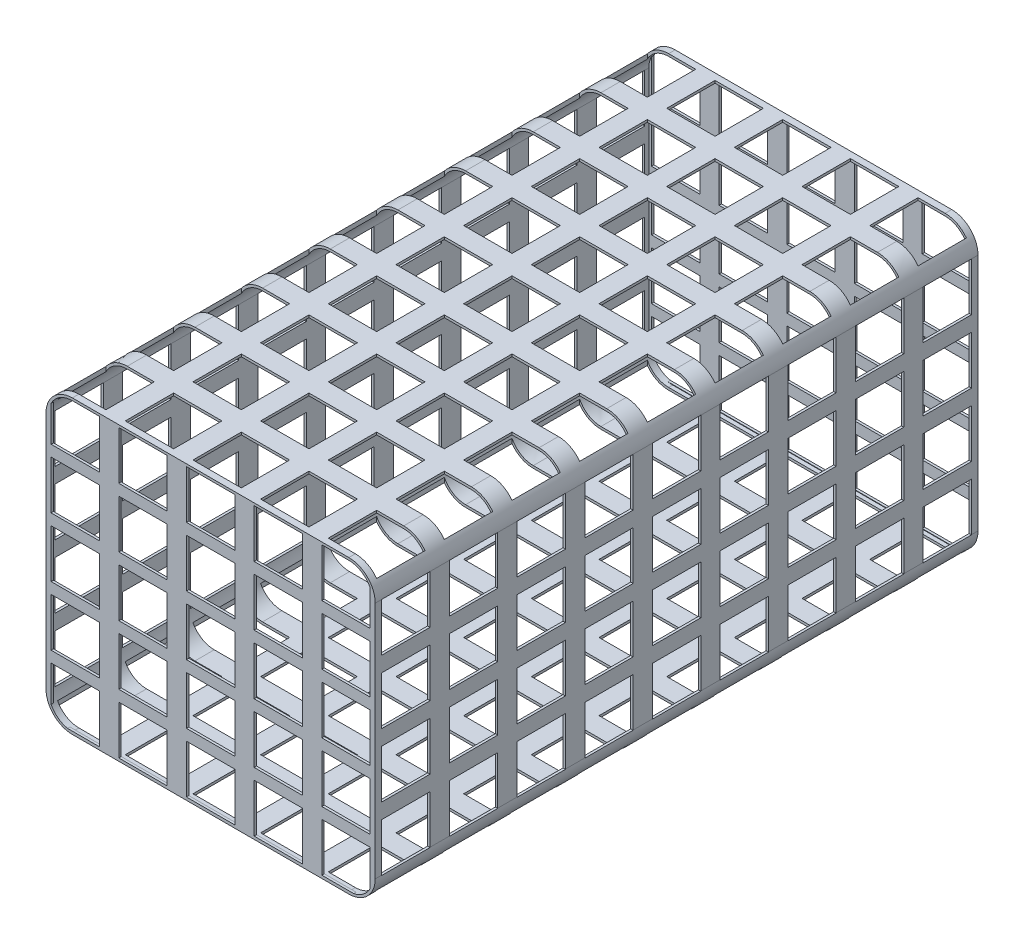
from build123d import *

# Parameters (mm, degrees)
BOSS_EXTRUDE2_DEPTH        = 158.369
SHELL1_T                   = 1.27
SKETCH4_W                  = 25.4
SKETCH4_H                  = 25.4
CUT_EXTRUDE1_DEPTH         = 237.684050105
MIRROR2_COPY_1_SKETCH_W    = 25.4
MIRROR2_COPY_1_SKETCH_H    = 25.4
MIRROR2_COPY_1_DEPTH       = 237.684050105
MIRROR2_COPY_2_SKETCH_W    = 25.4
MIRROR2_COPY_2_SKETCH_H    = 25.4
MIRROR2_COPY_2_DEPTH       = 237.684050105
SKETCH5_W                  = 25.4
SKETCH5_H                  = 25.4
CUT_EXTRUDE3_DEPTH         = 247.709129134
LPATTERN1_COUNT            = 4
LPATTERN1_PITCH            = 33.401
LPATTERN1_COUNT_DIR2       = 9
LPATTERN1_PITCH_DIR2       = 35.56
SKETCH6_W                  = 25.4
SKETCH6_H                  = 25.4
CUT_EXTRUDE4_DEPTH         = 338.146275931
LPATTERN2_COUNT            = 5
LPATTERN2_PITCH            = 31.242
LPATTERN3_COPY_1_SKETCH_W  = 25.4
LPATTERN3_COPY_1_SKETCH_H  = 25.4
LPATTERN3_COPY_1_DEPTH     = 338.146275931
LPATTERN3_COPY_2_SKETCH_W  = 25.4
LPATTERN3_COPY_2_SKETCH_H  = 25.4
LPATTERN3_COPY_2_DEPTH     = 338.146275931
LPATTERN3_COPY_3_SKETCH_W  = 25.4
LPATTERN3_COPY_3_SKETCH_H  = 25.4
LPATTERN3_COPY_3_DEPTH     = 338.146275931
LPATTERN3_COPY_4_SKETCH_W  = 25.4
LPATTERN3_COPY_4_SKETCH_H  = 25.4
LPATTERN3_COPY_4_DEPTH     = 338.146275931
LPATTERN3_COPY_5_SKETCH_W  = 25.4
LPATTERN3_COPY_5_SKETCH_H  = 25.4
LPATTERN3_COPY_5_DEPTH     = 338.146275931
LPATTERN3_COPY_6_SKETCH_W  = 25.4
LPATTERN3_COPY_6_SKETCH_H  = 25.4
LPATTERN3_COPY_6_DEPTH     = 338.146275931
LPATTERN3_COPY_7_SKETCH_W  = 25.4
LPATTERN3_COPY_7_SKETCH_H  = 25.4
LPATTERN3_COPY_7_DEPTH     = 338.146275931
LPATTERN3_COPY_8_SKETCH_W  = 25.4
LPATTERN3_COPY_8_SKETCH_H  = 25.4
LPATTERN3_COPY_8_DEPTH     = 338.146275931
LPATTERN3_COPY_9_SKETCH_W  = 25.4
LPATTERN3_COPY_9_SKETCH_H  = 25.4
LPATTERN3_COPY_9_DEPTH     = 338.146275931
LPATTERN3_COPY_10_SKETCH_W = 25.4
LPATTERN3_COPY_10_SKETCH_H = 25.4
LPATTERN3_COPY_10_DEPTH    = 338.146275931
LPATTERN3_COPY_11_SKETCH_W = 25.4
LPATTERN3_COPY_11_SKETCH_H = 25.4
LPATTERN3_COPY_11_DEPTH    = 338.146275931
LPATTERN3_COPY_12_SKETCH_W = 25.4
LPATTERN3_COPY_12_SKETCH_H = 25.4
LPATTERN3_COPY_12_DEPTH    = 338.146275931
LPATTERN3_COPY_13_SKETCH_W = 25.4
LPATTERN3_COPY_13_SKETCH_H = 25.4
LPATTERN3_COPY_13_DEPTH    = 338.146275931
LPATTERN3_COPY_14_SKETCH_W = 25.4
LPATTERN3_COPY_14_SKETCH_H = 25.4
LPATTERN3_COPY_14_DEPTH    = 338.146275931
LPATTERN3_COPY_15_SKETCH_W = 25.4
LPATTERN3_COPY_15_SKETCH_H = 25.4
LPATTERN3_COPY_15_DEPTH    = 338.146275931
SKETCH7_W                  = 25.4
SKETCH7_H                  = 25.4
CUT_EXTRUDE5_DEPTH         = 338.146275931


with BuildPart() as part:
    # Sketch1 → Boss-Extrude2 (new, symmetric)
    with BuildSketch(Plane.XY):
        with BuildLine():
            ThreePointArc((-86.487, -62.738), (-82.432479172, -72.526479172), (-72.644, -76.581))
            Line((-72.644, -76.581), (72.644, -76.581))
            ThreePointArc((72.644, -76.581), (82.432479172, -72.526479172), (86.487, -62.738))
            Line((86.487, -62.738), (86.487, 62.738))
            ThreePointArc((86.487, 62.738), (82.432479172, 72.526479172), (72.644, 76.581))
            Line((72.644, 76.581), (-72.644, 76.581))
            ThreePointArc((-72.644, 76.581), (-82.432479172, 72.526479172), (-86.487, 62.738))
            Line((-86.487, 62.738), (-86.487, -62.738))
        make_face()
    extrude(amount=BOSS_EXTRUDE2_DEPTH, both=True)

    # Shell1 (no face opened: a closed hollow body)
    add(offset(amount=-SHELL1_T, mode=Mode.PRIVATE), mode=Mode.SUBTRACT)

    # Sketch4 → Cut-Extrude1 (cut, through all)
    with BuildSketch(Plane(origin=(0, 76.581, 0), x_dir=(1, 0, 0), z_dir=(0, 1, 0))):
        with Locations((35.56, 0)):
            Rectangle(SKETCH4_W, SKETCH4_H)
        Rectangle(SKETCH4_W, SKETCH4_H)
        with Locations((71.12, 0)):
            Rectangle(SKETCH4_W, SKETCH4_H)
        with Locations((35.56, -35.56)):
            Rectangle(SKETCH4_W, SKETCH4_H)
        with Locations((71.12, -35.56)):
            Rectangle(SKETCH4_W, SKETCH4_H)
        with Locations((35.56, -71.12)):
            Rectangle(SKETCH4_W, SKETCH4_H)
        with Locations((71.12, -71.12)):
            Rectangle(SKETCH4_W, SKETCH4_H)
        with Locations((35.56, -106.68)):
            Rectangle(SKETCH4_W, SKETCH4_H)
        with Locations((71.12, -106.68)):
            Rectangle(SKETCH4_W, SKETCH4_H)
        with Locations((35.56, -142.24)):
            Rectangle(SKETCH4_W, SKETCH4_H)
        with Locations((71.12, -142.24)):
            Rectangle(SKETCH4_W, SKETCH4_H)
        with Locations((0, -35.56)):
            Rectangle(SKETCH4_W, SKETCH4_H)
        with Locations((0, -71.12)):
            Rectangle(SKETCH4_W, SKETCH4_H)
        with Locations((0, -106.68)):
            Rectangle(SKETCH4_W, SKETCH4_H)
        with Locations((0, -142.24)):
            Rectangle(SKETCH4_W, SKETCH4_H)
    cut_extrude1 = extrude(amount=-CUT_EXTRUDE1_DEPTH, mode=Mode.SUBTRACT)

    # Mirror1: Cut-Extrude1 across plane
    add(cut_extrude1.mirror(Plane.XY), mode=Mode.SUBTRACT)

    # Mirror2 copy 1 sketch → Mirror2 copy 1 (cut, through all)
    with BuildSketch(Plane(origin=(0, 76.581, 0), x_dir=(-1, 0, 0), z_dir=(0, 1, 0))):
        with Locations((35.56, 0)):
            Rectangle(MIRROR2_COPY_1_SKETCH_W, MIRROR2_COPY_1_SKETCH_H)
        Rectangle(MIRROR2_COPY_1_SKETCH_W, MIRROR2_COPY_1_SKETCH_H)
        with Locations((71.12, 0)):
            Rectangle(MIRROR2_COPY_1_SKETCH_W, MIRROR2_COPY_1_SKETCH_H)
        with Locations((35.56, -35.56)):
            Rectangle(MIRROR2_COPY_1_SKETCH_W, MIRROR2_COPY_1_SKETCH_H)
        with Locations((71.12, -35.56)):
            Rectangle(MIRROR2_COPY_1_SKETCH_W, MIRROR2_COPY_1_SKETCH_H)
        with Locations((35.56, -71.12)):
            Rectangle(MIRROR2_COPY_1_SKETCH_W, MIRROR2_COPY_1_SKETCH_H)
        with Locations((71.12, -71.12)):
            Rectangle(MIRROR2_COPY_1_SKETCH_W, MIRROR2_COPY_1_SKETCH_H)
        with Locations((35.56, -106.68)):
            Rectangle(MIRROR2_COPY_1_SKETCH_W, MIRROR2_COPY_1_SKETCH_H)
        with Locations((71.12, -106.68)):
            Rectangle(MIRROR2_COPY_1_SKETCH_W, MIRROR2_COPY_1_SKETCH_H)
        with Locations((35.56, -142.24)):
            Rectangle(MIRROR2_COPY_1_SKETCH_W, MIRROR2_COPY_1_SKETCH_H)
        with Locations((71.12, -142.24)):
            Rectangle(MIRROR2_COPY_1_SKETCH_W, MIRROR2_COPY_1_SKETCH_H)
        with Locations((0, -35.56)):
            Rectangle(MIRROR2_COPY_1_SKETCH_W, MIRROR2_COPY_1_SKETCH_H)
        with Locations((0, -71.12)):
            Rectangle(MIRROR2_COPY_1_SKETCH_W, MIRROR2_COPY_1_SKETCH_H)
        with Locations((0, -106.68)):
            Rectangle(MIRROR2_COPY_1_SKETCH_W, MIRROR2_COPY_1_SKETCH_H)
        with Locations((0, -142.24)):
            Rectangle(MIRROR2_COPY_1_SKETCH_W, MIRROR2_COPY_1_SKETCH_H)
    extrude(amount=-MIRROR2_COPY_1_DEPTH, mode=Mode.SUBTRACT)

    # Mirror2 copy 2 sketch → Mirror2 copy 2 (cut, through all)
    with BuildSketch(Plane(origin=(0, 76.581, 0), x_dir=(-1, 0, 0), z_dir=(0, 1, 0))):
        with Locations((35.56, 0)):
            Rectangle(MIRROR2_COPY_2_SKETCH_W, MIRROR2_COPY_2_SKETCH_H)
        Rectangle(MIRROR2_COPY_2_SKETCH_W, MIRROR2_COPY_2_SKETCH_H)
        with Locations((71.12, 0)):
            Rectangle(MIRROR2_COPY_2_SKETCH_W, MIRROR2_COPY_2_SKETCH_H)
        with Locations((35.56, 35.56)):
            Rectangle(MIRROR2_COPY_2_SKETCH_W, MIRROR2_COPY_2_SKETCH_H)
        with Locations((71.12, 35.56)):
            Rectangle(MIRROR2_COPY_2_SKETCH_W, MIRROR2_COPY_2_SKETCH_H)
        with Locations((35.56, 71.12)):
            Rectangle(MIRROR2_COPY_2_SKETCH_W, MIRROR2_COPY_2_SKETCH_H)
        with Locations((71.12, 71.12)):
            Rectangle(MIRROR2_COPY_2_SKETCH_W, MIRROR2_COPY_2_SKETCH_H)
        with Locations((35.56, 106.68)):
            Rectangle(MIRROR2_COPY_2_SKETCH_W, MIRROR2_COPY_2_SKETCH_H)
        with Locations((71.12, 106.68)):
            Rectangle(MIRROR2_COPY_2_SKETCH_W, MIRROR2_COPY_2_SKETCH_H)
        with Locations((35.56, 142.24)):
            Rectangle(MIRROR2_COPY_2_SKETCH_W, MIRROR2_COPY_2_SKETCH_H)
        with Locations((71.12, 142.24)):
            Rectangle(MIRROR2_COPY_2_SKETCH_W, MIRROR2_COPY_2_SKETCH_H)
        with Locations((0, 35.56)):
            Rectangle(MIRROR2_COPY_2_SKETCH_W, MIRROR2_COPY_2_SKETCH_H)
        with Locations((0, 71.12)):
            Rectangle(MIRROR2_COPY_2_SKETCH_W, MIRROR2_COPY_2_SKETCH_H)
        with Locations((0, 106.68)):
            Rectangle(MIRROR2_COPY_2_SKETCH_W, MIRROR2_COPY_2_SKETCH_H)
        with Locations((0, 142.24)):
            Rectangle(MIRROR2_COPY_2_SKETCH_W, MIRROR2_COPY_2_SKETCH_H)
    extrude(amount=-MIRROR2_COPY_2_DEPTH, mode=Mode.SUBTRACT)

    # Sketch5 → Cut-Extrude3 (cut, through all)
    with BuildSketch(Plane(origin=(86.487, 0, 0), x_dir=(0, 0, -1), z_dir=(1, 0, 0))):
        with Locations((-142.24, 50.038)):
            Rectangle(SKETCH5_W, SKETCH5_H)
    cut_extrude3 = extrude(amount=-CUT_EXTRUDE3_DEPTH, mode=Mode.SUBTRACT)

    # LPattern1: Cut-Extrude3 4 × 9
    with Locations(*[(0, -i * LPATTERN1_PITCH, -j * LPATTERN1_PITCH_DIR2) for i in range(LPATTERN1_COUNT) for j in range(LPATTERN1_COUNT_DIR2) if (i, j) != (0, 0)]):
        add(cut_extrude3, mode=Mode.SUBTRACT)

    # Sketch6 → Cut-Extrude4 (cut, through all)
    with BuildSketch(Plane.XY.offset(158.369)):
        with Locations((0, 62.611)):
            Rectangle(SKETCH6_W, SKETCH6_H)
    cut_extrude4 = extrude(amount=-CUT_EXTRUDE4_DEPTH, mode=Mode.SUBTRACT)

    # LPattern2: Cut-Extrude4 ×5
    with Locations(*[(0, -i * LPATTERN2_PITCH, 0) for i in range(1, LPATTERN2_COUNT)]):
        add(cut_extrude4, mode=Mode.SUBTRACT)

    # LPattern3 copy 1 sketch → LPattern3 copy 1 (cut, through all)
    with BuildSketch(Plane(origin=(35.56, -31.242, 158.369), x_dir=(1, 0, 0), z_dir=(0, 0, 1))):
        with Locations((0, 62.611)):
            Rectangle(LPATTERN3_COPY_1_SKETCH_W, LPATTERN3_COPY_1_SKETCH_H)
    extrude(amount=-LPATTERN3_COPY_1_DEPTH, mode=Mode.SUBTRACT)

    # LPattern3 copy 2 sketch → LPattern3 copy 2 (cut, through all)
    with BuildSketch(Plane(origin=(-35.56, -31.242, 158.369), x_dir=(1, 0, 0), z_dir=(0, 0, 1))):
        with Locations((0, 62.611)):
            Rectangle(LPATTERN3_COPY_2_SKETCH_W, LPATTERN3_COPY_2_SKETCH_H)
    extrude(amount=-LPATTERN3_COPY_2_DEPTH, mode=Mode.SUBTRACT)

    # LPattern3 copy 3 sketch → LPattern3 copy 3 (cut, through all)
    with BuildSketch(Plane(origin=(0, -31.242, 158.369), x_dir=(1, 0, 0), z_dir=(0, 0, 1))):
        with Locations((0, 62.611)):
            Rectangle(LPATTERN3_COPY_3_SKETCH_W, LPATTERN3_COPY_3_SKETCH_H)
    extrude(amount=-LPATTERN3_COPY_3_DEPTH, mode=Mode.SUBTRACT)

    # LPattern3 copy 4 sketch → LPattern3 copy 4 (cut, through all)
    with BuildSketch(Plane(origin=(35.56, -62.484, 158.369), x_dir=(1, 0, 0), z_dir=(0, 0, 1))):
        with Locations((0, 62.611)):
            Rectangle(LPATTERN3_COPY_4_SKETCH_W, LPATTERN3_COPY_4_SKETCH_H)
    extrude(amount=-LPATTERN3_COPY_4_DEPTH, mode=Mode.SUBTRACT)

    # LPattern3 copy 5 sketch → LPattern3 copy 5 (cut, through all)
    with BuildSketch(Plane(origin=(-35.56, -62.484, 158.369), x_dir=(1, 0, 0), z_dir=(0, 0, 1))):
        with Locations((0, 62.611)):
            Rectangle(LPATTERN3_COPY_5_SKETCH_W, LPATTERN3_COPY_5_SKETCH_H)
    extrude(amount=-LPATTERN3_COPY_5_DEPTH, mode=Mode.SUBTRACT)

    # LPattern3 copy 6 sketch → LPattern3 copy 6 (cut, through all)
    with BuildSketch(Plane(origin=(0, -62.484, 158.369), x_dir=(1, 0, 0), z_dir=(0, 0, 1))):
        with Locations((0, 62.611)):
            Rectangle(LPATTERN3_COPY_6_SKETCH_W, LPATTERN3_COPY_6_SKETCH_H)
    extrude(amount=-LPATTERN3_COPY_6_DEPTH, mode=Mode.SUBTRACT)

    # LPattern3 copy 7 sketch → LPattern3 copy 7 (cut, through all)
    with BuildSketch(Plane(origin=(35.56, -93.726, 158.369), x_dir=(1, 0, 0), z_dir=(0, 0, 1))):
        with Locations((0, 62.611)):
            Rectangle(LPATTERN3_COPY_7_SKETCH_W, LPATTERN3_COPY_7_SKETCH_H)
    extrude(amount=-LPATTERN3_COPY_7_DEPTH, mode=Mode.SUBTRACT)

    # LPattern3 copy 8 sketch → LPattern3 copy 8 (cut, through all)
    with BuildSketch(Plane(origin=(-35.56, -93.726, 158.369), x_dir=(1, 0, 0), z_dir=(0, 0, 1))):
        with Locations((0, 62.611)):
            Rectangle(LPATTERN3_COPY_8_SKETCH_W, LPATTERN3_COPY_8_SKETCH_H)
    extrude(amount=-LPATTERN3_COPY_8_DEPTH, mode=Mode.SUBTRACT)

    # LPattern3 copy 9 sketch → LPattern3 copy 9 (cut, through all)
    with BuildSketch(Plane(origin=(0, -93.726, 158.369), x_dir=(1, 0, 0), z_dir=(0, 0, 1))):
        with Locations((0, 62.611)):
            Rectangle(LPATTERN3_COPY_9_SKETCH_W, LPATTERN3_COPY_9_SKETCH_H)
    extrude(amount=-LPATTERN3_COPY_9_DEPTH, mode=Mode.SUBTRACT)

    # LPattern3 copy 10 sketch → LPattern3 copy 10 (cut, through all)
    with BuildSketch(Plane(origin=(35.56, -124.968, 158.369), x_dir=(1, 0, 0), z_dir=(0, 0, 1))):
        with Locations((0, 62.611)):
            Rectangle(LPATTERN3_COPY_10_SKETCH_W, LPATTERN3_COPY_10_SKETCH_H)
    extrude(amount=-LPATTERN3_COPY_10_DEPTH, mode=Mode.SUBTRACT)

    # LPattern3 copy 11 sketch → LPattern3 copy 11 (cut, through all)
    with BuildSketch(Plane(origin=(-35.56, -124.968, 158.369), x_dir=(1, 0, 0), z_dir=(0, 0, 1))):
        with Locations((0, 62.611)):
            Rectangle(LPATTERN3_COPY_11_SKETCH_W, LPATTERN3_COPY_11_SKETCH_H)
    extrude(amount=-LPATTERN3_COPY_11_DEPTH, mode=Mode.SUBTRACT)

    # LPattern3 copy 12 sketch → LPattern3 copy 12 (cut, through all)
    with BuildSketch(Plane(origin=(0, -124.968, 158.369), x_dir=(1, 0, 0), z_dir=(0, 0, 1))):
        with Locations((0, 62.611)):
            Rectangle(LPATTERN3_COPY_12_SKETCH_W, LPATTERN3_COPY_12_SKETCH_H)
    extrude(amount=-LPATTERN3_COPY_12_DEPTH, mode=Mode.SUBTRACT)

    # LPattern3 copy 13 sketch → LPattern3 copy 13 (cut, through all)
    with BuildSketch(Plane(origin=(35.56, 0, 158.369), x_dir=(1, 0, 0), z_dir=(0, 0, 1))):
        with Locations((0, 62.611)):
            Rectangle(LPATTERN3_COPY_13_SKETCH_W, LPATTERN3_COPY_13_SKETCH_H)
    extrude(amount=-LPATTERN3_COPY_13_DEPTH, mode=Mode.SUBTRACT)

    # LPattern3 copy 14 sketch → LPattern3 copy 14 (cut, through all)
    with BuildSketch(Plane(origin=(-35.56, 0, 158.369), x_dir=(1, 0, 0), z_dir=(0, 0, 1))):
        with Locations((0, 62.611)):
            Rectangle(LPATTERN3_COPY_14_SKETCH_W, LPATTERN3_COPY_14_SKETCH_H)
    extrude(amount=-LPATTERN3_COPY_14_DEPTH, mode=Mode.SUBTRACT)

    # LPattern3 copy 15 sketch → LPattern3 copy 15 (cut, through all)
    with BuildSketch(Plane.XY.offset(158.369)):
        with Locations((0, 62.611)):
            Rectangle(LPATTERN3_COPY_15_SKETCH_W, LPATTERN3_COPY_15_SKETCH_H)
    extrude(amount=-LPATTERN3_COPY_15_DEPTH, mode=Mode.SUBTRACT)

    # Sketch7 → Cut-Extrude5 (cut, through all)
    with BuildSketch(Plane.XY.offset(158.369)):
        with Locations((71.12, 0.127)):
            Rectangle(SKETCH7_W, SKETCH7_H)
        with Locations((71.12, 31.369)):
            Rectangle(SKETCH7_W, SKETCH7_H)
        with BuildLine():
            Line((72.644, 75.311), (58.42, 75.311))
            Line((58.42, 75.311), (58.42, 49.911))
            Line((58.42, 49.911), (83.82, 49.911))
            Line((83.82, 49.911), (83.82, 68.497978559))
            ThreePointArc((83.82, 68.497978559), (79.188467838, 73.473467838), (72.644, 75.311))
        make_face()
        with Locations((71.12, -31.115)):
            Rectangle(SKETCH7_W, SKETCH7_H)
        with BuildLine():
            Line((83.82, -68.497978559), (83.82, -49.657))
            Line((83.82, -49.657), (58.42, -49.657))
            Line((58.42, -49.657), (58.42, -75.057))
            Line((58.42, -75.057), (75.158471714, -75.057))
            ThreePointArc((75.158471714, -75.057), (80.234286194, -72.761366924), (83.82, -68.497978559))
        make_face()
    cut_extrude5 = extrude(amount=-CUT_EXTRUDE5_DEPTH, mode=Mode.SUBTRACT)

    # Mirror3: Cut-Extrude5 across plane
    add(cut_extrude5.mirror(Plane(origin=(0, 0, 0), x_dir=(0, 0, 1), z_dir=(1, 0, 0))), mode=Mode.SUBTRACT)


solid = part.part
